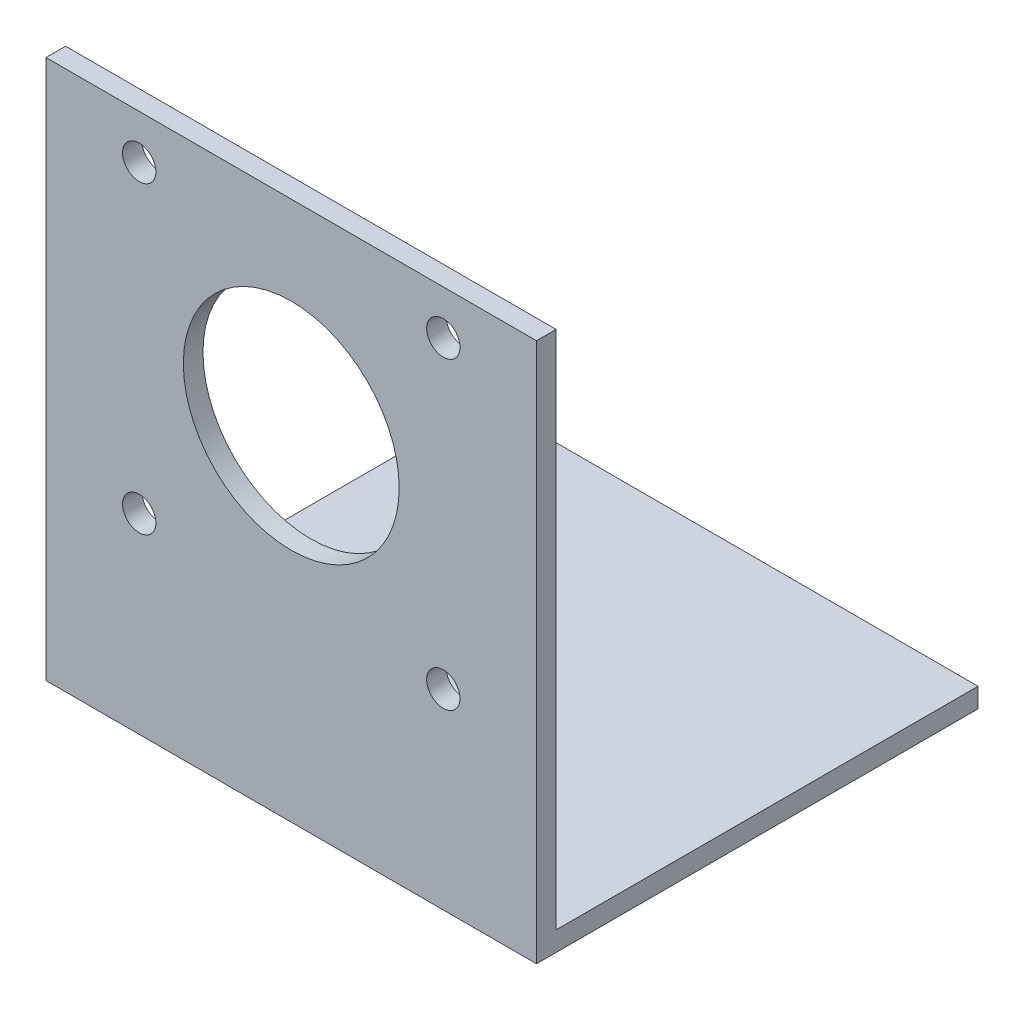
from build123d import *

# Parameters (mm, degrees)
SKETCH1_W               = 50
SKETCH1_H               = 55
BOSS_EXTRUDE1_DEPTH     = 2
SKETCH2_W               = 50
SKETCH2_H               = 2
BOSS_EXTRUDE2_DEPTH     = 45
CUT_EXTRUDE1_DEPTH      = 76.332595867
CUT_EXTRUDE1_DEPTH_BACK = 76.332595867
SKETCH3_R               = 1.7
LO_TAM_D22_DEPTH        = 76.332595867
LO_TAM_D22_DEPTH_BACK   = 76.332595867
SKETCH4_R               = 11


with BuildPart() as part:
    # Sketch1 → Boss-Extrude1 (new body)
    with BuildSketch(Plane.XY):
        with Locations((0, 27.5)):
            Rectangle(SKETCH1_W, SKETCH1_H)
    extrude(amount=-BOSS_EXTRUDE1_DEPTH)

    # Sketch2 → Boss-Extrude2 (add)
    with BuildSketch(Plane.XY):
        with Locations((0, 1)):
            Rectangle(SKETCH2_W, SKETCH2_H)
    extrude(amount=-BOSS_EXTRUDE2_DEPTH)

    # Sketch3 → Cut-Extrude1 (cut, two sides: drawn at the far end of the back side and taken through both)
    with BuildSketch(Plane.XY.offset(-CUT_EXTRUDE1_DEPTH_BACK)):
        with Locations((-15.5, 19.5)):
            Circle(SKETCH3_R)
        with Locations((-15.5, 50.5)):
            Circle(SKETCH3_R)
        with Locations((15.5, 19.5)):
            Circle(SKETCH3_R)
        with Locations((15.5, 50.5)):
            Circle(SKETCH3_R)
    extrude(amount=CUT_EXTRUDE1_DEPTH + CUT_EXTRUDE1_DEPTH_BACK, mode=Mode.SUBTRACT)

    # Sketch4 → Lo_tam_D22 (cut, two sides: drawn at the far end of the back side and taken through both)
    with BuildSketch(Plane.XY.offset(-LO_TAM_D22_DEPTH_BACK)):
        with Locations((0, 35)):
            Circle(SKETCH4_R)
    extrude(amount=LO_TAM_D22_DEPTH + LO_TAM_D22_DEPTH_BACK, mode=Mode.SUBTRACT)


solid = part.part
